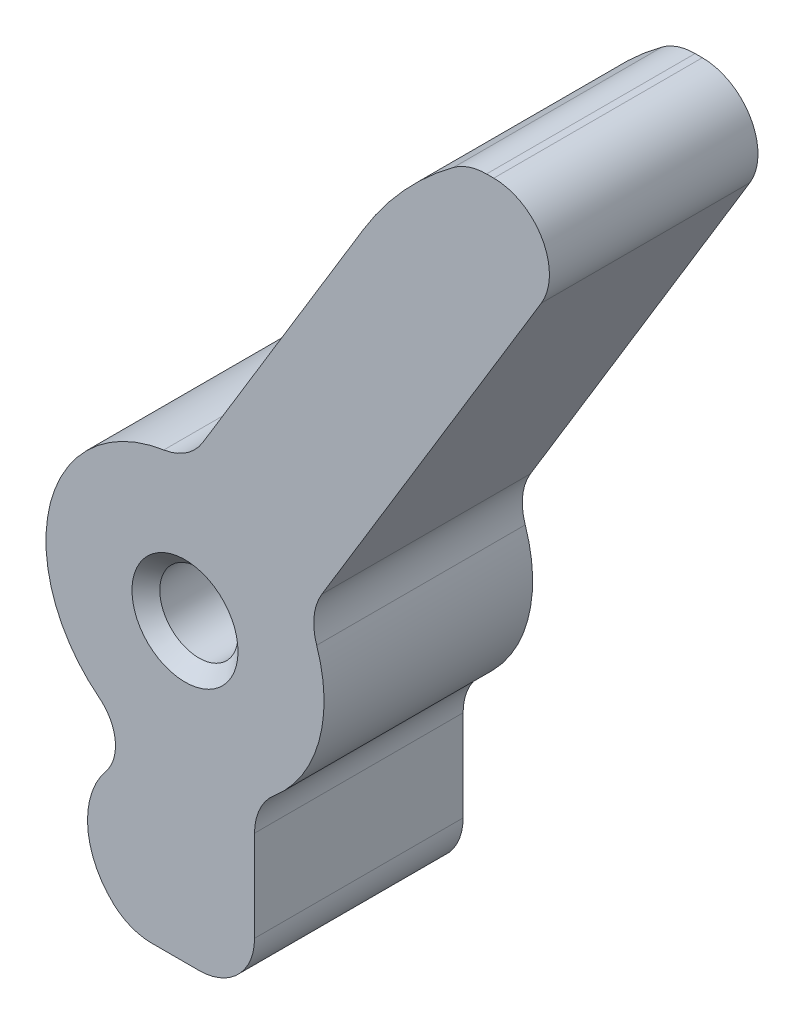
from build123d import *

# Parameters (mm, degrees)
BOSS_EXTRUDE1_DEPTH = 4.7625
SKETCH2_R           = 6.35
BOSS_EXTRUDE2_DEPTH = 9.525
FILLET1_R           = 2.54
FILLET2_START       = -4.7625
FILLET2_DEPTH       = 9.525


with BuildPart() as part:
    # Sketch1 → Boss-Extrude1 (new, symmetric)
    with BuildSketch(Plane.XY):
        with BuildLine():
            ThreePointArc((22.094337813, 8.067740847), (24.226136754, 10.836108919), (26.914852205, 13.067529481))
            Line((26.914852205, 13.067529481), (32.554450869, 13.067529481))
            Line((32.554450869, 13.067529481), (17.117145822, -12.379943283))
            Line((17.117145822, -12.379943283), (17.117145822, -24.9994))
            Line((17.117145822, -24.9994), (11.719856102, -24.9994))
            ThreePointArc((11.719856102, -24.9994), (9.533586303, -22.160148794), (10.767145822, -18.795709173))
            Line((10.767145822, -18.795709173), (10.767145822, -10.604456717))
            Line((10.767145822, -10.604456717), (22.094337813, 8.067740847))
        make_face()
    extrude(amount=BOSS_EXTRUDE1_DEPTH, both=True)

    # Sketch2 → Boss-Extrude2 (add, through all)
    with BuildSketch(Plane.XY.offset(4.7625)):
        with Locations((13.942145822, -11.4922)):
            Circle(SKETCH2_R)
    extrude(amount=-BOSS_EXTRUDE2_DEPTH)

    # Sketch3 → 9/64 (0.14063) Diameter Hole1 (revolve, cut)
    with BuildSketch(Plane(origin=(13.942145822, -11.4922, 4.7625), x_dir=(0, -1, 0), z_dir=(1, 0, 0))):
        Polygon((0, 0), (0, 9.525), (2.421001, 9.525), (1.786001, 8.89), (1.786001, 0.635), (2.421001, 0), align=None)
    revolve(axis=Axis((13.942145822, -11.4922, 11.1125), (0, 0, -1)), mode=Mode.SUBTRACT)

    # Fillet1
    fillet1_edges = [part.edges().sort_by_distance(p)[0] for p in [
        (26.914852205, 13.067529481, 0),
        (32.554450869, 13.067529481, 0),
        (17.117145822, -24.9994, 0),
        (11.719856102, -24.9994, 0),
        (14.079831445, -5.143692879, 0),
        (17.117145822, -16.991461314, 0),
        (19.508957077, -8.437185686, 0),
    ]]
    fillet(fillet1_edges, radius=FILLET1_R)

    # Fillet2: read off the stored shape, not the designer's step
    # Fillet2 outline → Fillet2 (add)
    with BuildSketch(Plane.XY.offset(FILLET2_START)):
        with BuildLine():
            add(Edge.make_bspline(
                [(10.767145822, -18.017877519), (10.767145823, -17.393004157), (10.487472268, -16.852808402), (10.023052756, -16.488519599)],
                knots=[0.43435667, 0.43435667, 0.43435667, 0.43435667, 1, 1, 1, 1], degree=3, weights=[0.852569416, 0.837715519, 0.886859046, 1]))
            Line((10.767145822, -18.017877519), (10.767145822, -16.991461314))
            ThreePointArc((10.767145822, -16.991461314), (10.386196343, -16.753162203), (10.023052756, -16.488519599))
        make_face()
        with BuildLine():
            add(Edge.make_bspline(
                [(10.328377861, -19.24798429), (10.606973983, -18.907141934), (10.767145822, -18.483132326), (10.767145822, -18.017877519)],
                knots=[0, 0, 0, 0, 0.43435667, 0.43435667, 0.43435667, 0.43435667], degree=3, weights=[1, 0.91311923, 0.863975702, 0.852569416]))
            ThreePointArc((10.328377861, -19.24798429), (10.538145849, -19.01251792), (10.767145822, -18.795709173))
            Line((10.767145822, -18.795709173), (10.767145822, -18.017877519))
        make_face()
    extrude(amount=FILLET2_DEPTH)


solid = part.part
